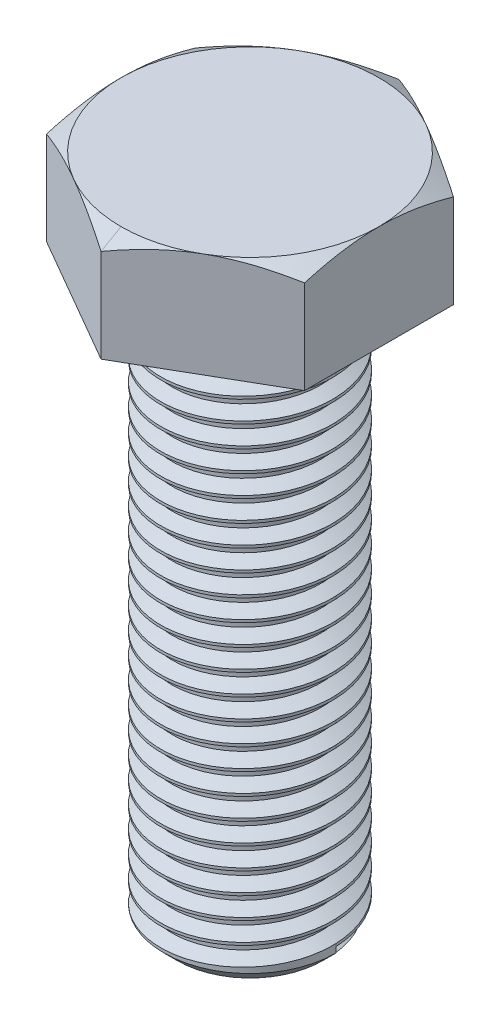
from build123d import *

# Parameters (mm, degrees)
SKETCH1_R           = 12.7
BOSS_EXTRUDE1_DEPTH = 82.55
CHAMFER1_SIZE       = 1.94764025
THREAD1_PITCH       = 3.175
BOSS_EXTRUDE2_DEPTH = 15.478125


with BuildPart() as part:
    # Sketch1 → Boss-Extrude1 (new body)
    with BuildSketch(Plane(origin=(0, 0, 0), x_dir=(1, 0, 0), z_dir=(0, 1, 0))):
        with Locations(Location((0, 0, 0), (0, 0, 270))):
            Circle(SKETCH1_R)
    extrude(amount=BOSS_EXTRUDE1_DEPTH)

    # Chamfer1
    chamfer1_edges = [part.edges().sort_by_distance(p)[0] for p in [
        (0, 0, -12.7),
    ]]
    chamfer(chamfer1_edges, length=CHAMFER1_SIZE)

    # Thread1: the profile of Thread Profile1 profile screwed along a right-hand helix of 25 turns, 12 arcs to a turn; built about Z, then put on its axis
    thread1_z = Axis((0, 0, 0), (0, 0, 1))
    thread1_corners = [(12.7003, 0, -0.000173205), (12.7003, 0, 2.778298196), (10.981480847, 0, 1.785937496), (10.981480847, 0, 0.992187496)]
    with BuildLine(mode=Mode.PRIVATE) as thread1_profile:
        Line(thread1_corners[0], thread1_corners[1])
        Line(thread1_corners[1], thread1_corners[2])
        Line(thread1_corners[2], thread1_corners[3])
        Line(thread1_corners[3], thread1_corners[0])
    thread1_cap = Face(thread1_profile.wire())
    thread1_turn_angles = [0, 15, 30, 45, 60, 75, 90, 105, 120, 135, 150, 165, 180, 195, 210, 225, 240, 255, 270, 285, 300, 315, 330, 345, 360]
    thread1_turn_weights = [1, 0.9659258262890683, 1, 0.9659258262890683, 1, 0.9659258262890683, 1, 0.9659258262890683, 1, 0.9659258262890683, 1, 0.9659258262890683, 1, 0.9659258262890683, 1, 0.9659258262890683, 1, 0.9659258262890683, 1, 0.9659258262890683, 1, 0.9659258262890683, 1, 0.9659258262890683, 1]
    thread1_turn_rails = [Edge.make_bspline([Vector(p[0], p[1], 0).rotate(thread1_z, thread1_turn_angles[k]) / thread1_turn_weights[k] + Vector(0, 0, p[2] + THREAD1_PITCH * thread1_turn_angles[k] / 360) for k in range(25)], [0, 0, 0, 1, 1, 2, 2, 3, 3, 4, 4, 5, 5, 6, 6, 7, 7, 8, 8, 9, 9, 10, 10, 11, 11, 12, 12, 12], 2, thread1_turn_weights) for p in thread1_corners]
    thread1_turn_sides = [Face.make_surface_from_curves(thread1_turn_rails[p[0]], thread1_turn_rails[p[1]]) for p in [(0, 1), (1, 2), (2, 3), (3, 0)]]
    thread1 = Plane(origin=(0, 0, 0), x_dir=(1, 0, 0), z_dir=(0, 1, 0)) * Solid(Shell([*[p.moved(Location((0, 0, THREAD1_PITCH * i))) for i in range(25) for p in thread1_turn_sides], thread1_cap, thread1_cap.rotate(thread1_z, 9000).moved(Location((0, 0, THREAD1_PITCH * 9000 / 360)))]))
    add(thread1, mode=Mode.SUBTRACT)

    # Sketch5 → Boss-Extrude2 (add)
    with BuildSketch(Plane(origin=(0, 82.55, 0), x_dir=(1, 0, 0), z_dir=(0, 1, 0))):
        Polygon((0, -21.997045256), (19.05, -10.998522628), (19.05, 10.998522628), (0, 21.997045256), (-19.05, 10.998522628), (-19.05, -10.998522628), align=None)
    extrude(amount=BOSS_EXTRUDE2_DEPTH)

    # Cut-Sweep1: sweep along a path in Sketch6
    with BuildLine(Plane(origin=(0, 98.028125, 0), x_dir=(1, 0, 0), z_dir=(0, 1, 0))) as cut_sweep1_path:
        CenterArc((0, 0), 19.05, 0, 360)
    # Sketch7 → Cut-Sweep1 (sweep, cut)
    with BuildSketch(Plane(origin=(0, 0, 0), x_dir=(0, 0, -1), z_dir=(1, 0, 0))):
        Polygon((-19.05, 98.028125), (-21.997045256, 98.028125), (-21.997045256, 96.326647628), align=None)
    sweep(path=cut_sweep1_path.line, mode=Mode.SUBTRACT)


solid = part.part
